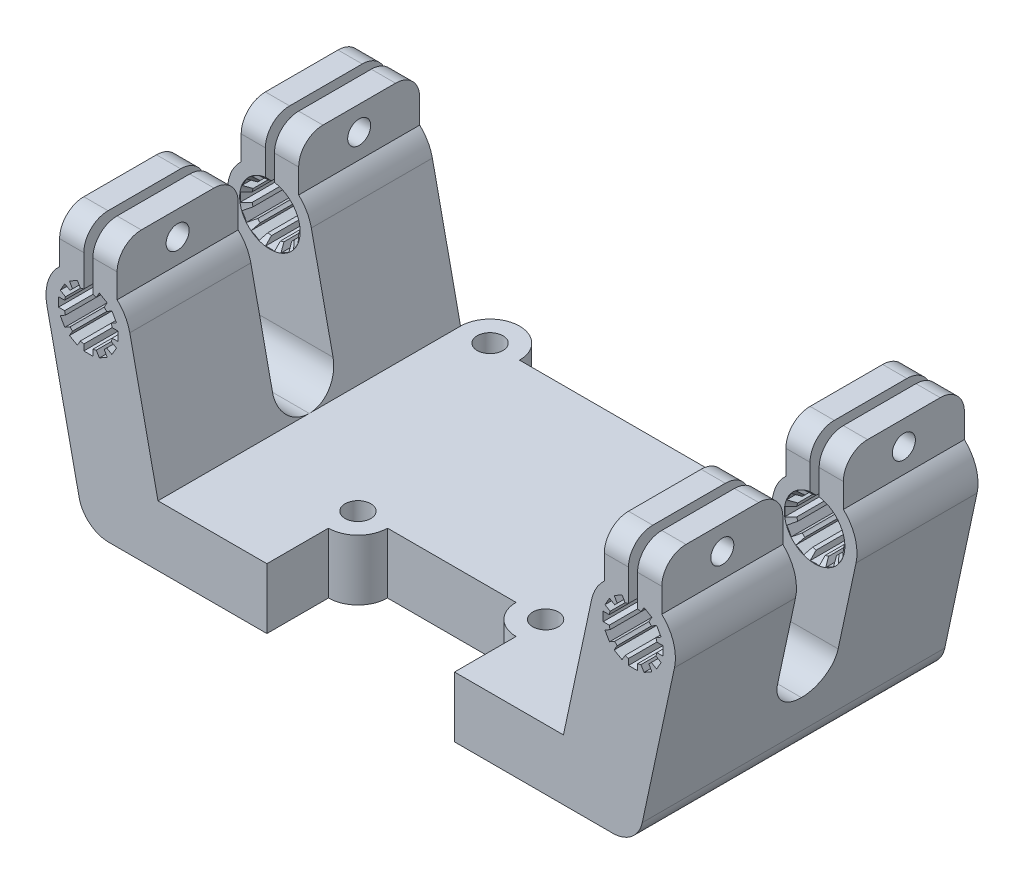
from build123d import *

# Parameters (mm, degrees)
SKETCH1_R                       = 2.125
BOSS_EXTRUDE1_DEPTH             = 10
BOSS_EXTRUDE3_REACH             = 46.442
BOSS_EXTRUDE3_DIRECTION_2_REACH = 46.442
SKETCH6_W                       = 1.5
SKETCH6_H                       = 1
SKETCH6_W_2                     = 1
SKETCH6_H_2                     = 1.5
CUT_EXTRUDE2_DEPTH              = 50
CUT_EXTRUDE3_DEPTH              = 74.069291688
CUT_EXTRUDE3_DEPTH_BACK         = 74.069291688
SKETCH7_W                       = 10
SKETCH7_H                       = 33.385538852
FILLET9_R                       = 5
SKETCH10_R                      = 1.9
CUT_EXTRUDE4_DEPTH              = 114.965713712
FILLET12_R                      = 4


with BuildPart() as part:
    # Sketch1 → Boss-Extrude1 (new body)
    with BuildSketch(Plane(origin=(0, 0, 0), x_dir=(1, 0, 0), z_dir=(0, 1, 0))):
        with BuildLine():
            Line((23.75, 22.5625), (-23.75, 22.5625))
            ThreePointArc((-23.75, 22.5625), (-28.625, 27.4375), (-33.5, 22.5625))
            Line((-33.5, 22.5625), (-33.5, -27.4375))
            Line((-33.5, -27.4375), (-27, -27.4375))
            Line((-27, -27.4375), (-22, -27.4375))
            Line((-22, -27.4375), (-15.5, -27.4375))
            Line((-15.5, -27.4375), (-15.5, -17.2625))
            ThreePointArc((-15.5, -17.2625), (-12.052854442, -15.834645558), (-10.625, -12.3875))
            Line((-10.625, -12.3875), (10.625, -12.3875))
            ThreePointArc((10.625, -12.3875), (12.052854442, -15.834645558), (15.5, -17.2625))
            Line((15.5, -17.2625), (15.5, -27.4375))
            Line((15.5, -27.4375), (22, -27.4375))
            Line((22, -27.4375), (27, -27.4375))
            Line((27, -27.4375), (33.5, -27.4375))
            Line((33.5, -27.4375), (33.5, 22.5625))
            ThreePointArc((33.5, 22.5625), (28.625, 27.4375), (23.75, 22.5625))
        make_face()
        with Locations(Location((-28.625, 22.5625, 0), (0, 0, 270))):
            Circle(SKETCH1_R, mode=Mode.SUBTRACT)
        with Locations(Location((-15.5, -12.3875, 0), (0, 0, 270))):
            Circle(SKETCH1_R, mode=Mode.SUBTRACT)
        with Locations(Location((15.5, -12.3875, 0), (0, 0, 270))):
            Circle(SKETCH1_R, mode=Mode.SUBTRACT)
        with Locations(Location((28.625, 22.5625, 0), (0, 0, 270))):
            Circle(SKETCH1_R, mode=Mode.SUBTRACT)
    extrude(amount=BOSS_EXTRUDE1_DEPTH)

    # Boss-Extrude3: up to this face of the body (flat: up to its plane)
    boss_extrude3_end = Plane(part.part.faces().sort_by_distance((-24.5, 5, 27.4375))[0])
    # Sketch5 → Boss-Extrude3 (add, up to the picked face)
    with BuildSketch(Plane.XY, mode=Mode.PRIVATE) as boss_extrude3_sk1:
        with BuildLine():
            Line((-33.5, 10), (-38.155585507, 31.711445762))
            ThreePointArc((-38.155585507, 31.711445762), (-38.91868831, 33.710445869), (-40.25, 35.385538852))
            Line((-40.25, 35.385538852), (-40.25, 43.385538852))
            Line((-40.25, 43.385538852), (-44.25, 43.385538852))
            Line((-44.25, 43.385538852), (-44.25, 34.172856313))
            ThreePointArc((-44.25, 34.172856313), (-45, 26.243797902), (-45.75, 34.172856313))
            Line((-45.75, 34.172856313), (-45.75, 43.385538852))
            Line((-45.75, 43.385538852), (-49.75, 43.385538852))
            Line((-49.75, 43.385538852), (-49.75, 35.385538852))
            ThreePointArc((-49.75, 35.385538852), (-51.67297662, 32.358362402), (-51.844414493, 28.776150041))
            Line((-51.844414493, 28.776150041), (-45.673944386, 0))
            Line((-45.673944386, 0), (-33.5, 0))
            Line((-33.5, 0), (-33.5, 10))
        make_face()
    boss_extrude3_tool1 = split(extrude(boss_extrude3_sk1.sketch, amount=BOSS_EXTRUDE3_REACH, mode=Mode.PRIVATE), bisect_by=boss_extrude3_end, keep=Keep.BOTH, mode=Mode.PRIVATE)
    boss_extrude3 = boss_extrude3_tool1.solids().sort_by(Axis((-42.44705, 19.174072, 0), (0, 0, 1)))[0]
    add(boss_extrude3)

    # Boss-Extrude3 direction 2: up to this face of the body (flat: up to its plane)
    boss_extrude3_direction_2_end = Plane(part.part.faces().sort_by_distance((0, 5, -22.5625))[0])
    # Sketch5 → Boss-Extrude3 direction 2 (add, up to the picked face)
    with BuildSketch(Plane.XY, mode=Mode.PRIVATE) as boss_extrude3_direction_2_sk1:
        with BuildLine():
            Line((-33.5, 10), (-38.155585507, 31.711445762))
            ThreePointArc((-38.155585507, 31.711445762), (-38.91868831, 33.710445869), (-40.25, 35.385538852))
            Line((-40.25, 35.385538852), (-40.25, 43.385538852))
            Line((-40.25, 43.385538852), (-44.25, 43.385538852))
            Line((-44.25, 43.385538852), (-44.25, 34.172856313))
            ThreePointArc((-44.25, 34.172856313), (-45, 26.243797902), (-45.75, 34.172856313))
            Line((-45.75, 34.172856313), (-45.75, 43.385538852))
            Line((-45.75, 43.385538852), (-49.75, 43.385538852))
            Line((-49.75, 43.385538852), (-49.75, 35.385538852))
            ThreePointArc((-49.75, 35.385538852), (-51.67297662, 32.358362402), (-51.844414493, 28.776150041))
            Line((-51.844414493, 28.776150041), (-45.673944386, 0))
            Line((-45.673944386, 0), (-33.5, 0))
            Line((-33.5, 0), (-33.5, 10))
        make_face()
    boss_extrude3_direction_2_tool1 = split(extrude(boss_extrude3_direction_2_sk1.sketch, amount=-BOSS_EXTRUDE3_DIRECTION_2_REACH, mode=Mode.PRIVATE), bisect_by=boss_extrude3_direction_2_end, keep=Keep.BOTH, mode=Mode.PRIVATE)
    boss_extrude3_direction_2 = boss_extrude3_direction_2_tool1.solids().sort_by(Axis((-42.44705, 19.174072, 0), (0, 0, -1)))[0]
    add(boss_extrude3_direction_2)

    # Mirror2: Boss-Extrude3, Boss-Extrude3 direction 2 across plane
    add(boss_extrude3.mirror(Plane(origin=(0, 0, 0), x_dir=(0, 0, 1), z_dir=(1, 0, 0))))
    add(boss_extrude3_direction_2.mirror(Plane(origin=(0, 0, 0), x_dir=(0, 0, 1), z_dir=(1, 0, 0))))

    # Sketch6 → Cut-Extrude2 (cut)
    with BuildSketch(Plane.XY.offset(27.4375)):
        with Locations((-45, 34.672856313)):
            Rectangle(SKETCH6_W, SKETCH6_H)
        Polygon((-43.184995739, 34.887487795), (-43.684995739, 34.021462391), (-42.385957634, 33.271462391), (-41.885957634, 34.137487795), align=None)
        Polygon((-41.106321148, 33.357849278), (-41.972346551, 32.857849278), (-41.222346551, 31.558811173), (-40.356321148, 32.058811173), align=None)
        with Locations((-40.570955404, 30.243806168)):
            Rectangle(SKETCH6_W_2, SKETCH6_H_2)
        Polygon((-40.356323922, 28.428801908), (-41.222349325, 28.928801908), (-41.972349325, 27.629763802), (-41.106323922, 27.129763802), align=None)
        Polygon((-41.885962438, 26.350127316), (-42.385962438, 27.21615272), (-43.685000544, 26.46615272), (-43.185000544, 25.600127316), align=None)
        with Locations((-45.000005548, 25.814761572)):
            Rectangle(SKETCH6_W, SKETCH6_H)
        Polygon((-46.815009809, 25.60013009), (-46.315009809, 26.466155494), (-47.614047915, 27.216155494), (-48.114047915, 26.35013009), align=None)
        Polygon((-48.8936844, 27.129768607), (-48.027658997, 27.629768607), (-48.777658997, 28.928806712), (-49.6436844, 28.428806712), align=None)
        with Locations((-49.429050145, 30.243811717)):
            Rectangle(SKETCH6_W_2, SKETCH6_H_2)
        Polygon((-49.643681626, 32.058815977), (-48.777656223, 31.558815977), (-48.027656223, 32.857854083), (-48.893681626, 33.357854083), align=None)
        Polygon((-48.11404311, 34.137490569), (-47.61404311, 33.271465165), (-46.315005004, 34.021465165), (-46.815005004, 34.887490569), align=None)
    cut_extrude2 = extrude(amount=-CUT_EXTRUDE2_DEPTH, mode=Mode.SUBTRACT)

    # Mirror3: Cut-Extrude2 across plane
    add(cut_extrude2.mirror(Plane(origin=(0, 0, 0), x_dir=(0, 0, 1), z_dir=(1, 0, 0))), mode=Mode.SUBTRACT)

    # Sketch7 → Cut-Extrude3 (cut, two sides: drawn at the far end of the back side and taken through both)
    with BuildSketch(Plane(origin=(0, 0, 0), x_dir=(0, 0, -1), z_dir=(1, 0, 0)).offset(-CUT_EXTRUDE3_DEPTH_BACK)):
        with Locations((-2.4375, 26.692769426)):
            Rectangle(SKETCH7_W, SKETCH7_H)
    extrude(amount=CUT_EXTRUDE3_DEPTH + CUT_EXTRUDE3_DEPTH_BACK, mode=Mode.SUBTRACT)

    # Fillet9
    fillet9_edges = [part.edges().sort_by_distance(p)[0] for p in [
        (-45.673944386, 0, 2.4375),
        (45.673944386, 0, 2.4375),
        (40.659122237, 10, 7.4375),
        (40.659122237, 10, -2.5625),
        (-40.659122237, 10, 7.4375),
        (-40.659122237, 10, -2.5625),
    ]]
    fillet(fillet9_edges, radius=FILLET9_R - 0.0001)  # a hair under: the kernel refuses the full size

    # Chamfer4: read off the stored shape, not the designer's step
    # Chamfer4: loft between two sections, ruled curve by curve
    chamfer4_from = [
        Edge.make_three_point_arc((44.400000709, 34.198537216, -3.562504726), (41.011334762, 29.94294609, -3.562504726), (45, 26.243802628, -3.562504726)),
        Edge.make_three_point_arc((45, 26.243802628, -3.562504726), (48.988665238, 29.94294609, -3.562504726), (45.599999291, 34.198537216, -3.562504726)),
        Edge.make_line((45.599999291, 34.198537216, -3.562504726), (44.400000709, 34.198537216, -3.562504726)),
    ]
    chamfer4_to = [
        Edge.make_three_point_arc((44.25, 35.187227885, -2.5625), (40.014162562, 29.867732692, -2.5625), (45, 25.243797902, -2.5625)),
        Edge.make_three_point_arc((45, 25.243797902, -2.5625), (49.985837438, 29.867732692, -2.5625), (45.75, 35.187227885, -2.5625)),
        Edge.make_line((45.75, 35.187227885, -2.5625), (44.25, 35.187227885, -2.5625)),
    ]
    chamfer4 = Solid(Shell([*[Face.make_surface_from_curves(chamfer4_from[k], chamfer4_to[k]) for k in range(3)], Face(Wire(chamfer4_from)), Face(Wire(chamfer4_to))]))
    add(chamfer4, mode=Mode.SUBTRACT)

    # Chamfer4 2: loft between two sections, ruled curve by curve
    chamfer4_2_from = [
        Edge.make_three_point_arc((45.599999301, 34.198537284, -21.562495342), (48.988665306, 29.942946084, -21.562495342), (45, 26.243802559, -21.562495342)),
        Edge.make_three_point_arc((45, 26.243802559, -21.562495342), (41.011334694, 29.942946084, -21.562495342), (44.400000699, 34.198537284, -21.562495342)),
        Edge.make_line((44.400000699, 34.198537284, -21.562495342), (45.599999301, 34.198537284, -21.562495342)),
    ]
    chamfer4_2_to = [
        Edge.make_three_point_arc((45.75, 35.187227885, -22.5625), (49.985837438, 29.867732692, -22.5625), (45, 25.243797902, -22.5625)),
        Edge.make_three_point_arc((45, 25.243797902, -22.5625), (40.014162562, 29.867732692, -22.5625), (44.25, 35.187227885, -22.5625)),
        Edge.make_line((44.25, 35.187227885, -22.5625), (45.75, 35.187227885, -22.5625)),
    ]
    chamfer4_2 = Solid(Shell([*[Face.make_surface_from_curves(chamfer4_2_from[k], chamfer4_2_to[k]) for k in range(3)], Face(Wire(chamfer4_2_from)), Face(Wire(chamfer4_2_to))]))
    add(chamfer4_2, mode=Mode.SUBTRACT)

    # Chamfer4 3: loft between two sections, ruled curve by curve
    chamfer4_3_from = [
        Edge.make_three_point_arc((45.599999301, 34.198537284, 8.437504658), (48.988665306, 29.942946084, 8.437504658), (45, 26.243802559, 8.437504658)),
        Edge.make_three_point_arc((45, 26.243802559, 8.437504658), (41.011334694, 29.942946084, 8.437504658), (44.400000699, 34.198537284, 8.437504658)),
        Edge.make_line((44.400000699, 34.198537284, 8.437504658), (45.599999301, 34.198537284, 8.437504658)),
    ]
    chamfer4_3_to = [
        Edge.make_three_point_arc((45.75, 35.187227885, 7.4375), (49.985837438, 29.867732692, 7.4375), (45, 25.243797902, 7.4375)),
        Edge.make_three_point_arc((45, 25.243797902, 7.4375), (40.014162562, 29.867732692, 7.4375), (44.25, 35.187227885, 7.4375)),
        Edge.make_line((44.25, 35.187227885, 7.4375), (45.75, 35.187227885, 7.4375)),
    ]
    chamfer4_3 = Solid(Shell([*[Face.make_surface_from_curves(chamfer4_3_from[k], chamfer4_3_to[k]) for k in range(3)], Face(Wire(chamfer4_3_from)), Face(Wire(chamfer4_3_to))]))
    add(chamfer4_3, mode=Mode.SUBTRACT)

    # Chamfer4 4: loft between two sections, ruled curve by curve
    chamfer4_4_from = [
        Edge.make_three_point_arc((-45.599999301, 34.198537284, -3.562504658), (-48.988665306, 29.942946084, -3.562504658), (-45, 26.243802559, -3.562504658)),
        Edge.make_three_point_arc((-45, 26.243802559, -3.562504658), (-41.011334694, 29.942946084, -3.562504658), (-44.400000699, 34.198537284, -3.562504658)),
        Edge.make_line((-44.400000699, 34.198537284, -3.562504658), (-45.599999301, 34.198537284, -3.562504658)),
    ]
    chamfer4_4_to = [
        Edge.make_three_point_arc((-45.75, 35.187227885, -2.5625), (-49.985837438, 29.867732692, -2.5625), (-45, 25.243797902, -2.5625)),
        Edge.make_three_point_arc((-45, 25.243797902, -2.5625), (-40.014162562, 29.867732692, -2.5625), (-44.25, 35.187227885, -2.5625)),
        Edge.make_line((-44.25, 35.187227885, -2.5625), (-45.75, 35.187227885, -2.5625)),
    ]
    chamfer4_4 = Solid(Shell([*[Face.make_surface_from_curves(chamfer4_4_from[k], chamfer4_4_to[k]) for k in range(3)], Face(Wire(chamfer4_4_from)), Face(Wire(chamfer4_4_to))]))
    add(chamfer4_4, mode=Mode.SUBTRACT)

    # Chamfer4 5: loft between two sections, ruled curve by curve
    chamfer4_5_from = [
        Edge.make_three_point_arc((-44.400000709, 34.198537216, 8.437504726), (-41.011334762, 29.94294609, 8.437504726), (-45, 26.243802628, 8.437504726)),
        Edge.make_three_point_arc((-45, 26.243802628, 8.437504726), (-48.988665238, 29.94294609, 8.437504726), (-45.599999291, 34.198537216, 8.437504726)),
        Edge.make_line((-45.599999291, 34.198537216, 8.437504726), (-44.400000709, 34.198537216, 8.437504726)),
    ]
    chamfer4_5_to = [
        Edge.make_three_point_arc((-44.25, 35.187227885, 7.4375), (-40.014162562, 29.867732692, 7.4375), (-45, 25.243797902, 7.4375)),
        Edge.make_three_point_arc((-45, 25.243797902, 7.4375), (-49.985837438, 29.867732692, 7.4375), (-45.75, 35.187227885, 7.4375)),
        Edge.make_line((-45.75, 35.187227885, 7.4375), (-44.25, 35.187227885, 7.4375)),
    ]
    chamfer4_5 = Solid(Shell([*[Face.make_surface_from_curves(chamfer4_5_from[k], chamfer4_5_to[k]) for k in range(3)], Face(Wire(chamfer4_5_from)), Face(Wire(chamfer4_5_to))]))
    add(chamfer4_5, mode=Mode.SUBTRACT)

    # Chamfer4 6: loft between two sections, ruled curve by curve
    chamfer4_6_from = [
        Edge.make_three_point_arc((-44.400000709, 34.198537216, -21.562495274), (-41.011334762, 29.94294609, -21.562495274), (-45, 26.243802628, -21.562495274)),
        Edge.make_three_point_arc((-45, 26.243802628, -21.562495274), (-48.988665238, 29.94294609, -21.562495274), (-45.599999291, 34.198537216, -21.562495274)),
        Edge.make_line((-45.599999291, 34.198537216, -21.562495274), (-44.400000709, 34.198537216, -21.562495274)),
    ]
    chamfer4_6_to = [
        Edge.make_three_point_arc((-44.25, 35.187227885, -22.5625), (-40.014162562, 29.867732692, -22.5625), (-45, 25.243797902, -22.5625)),
        Edge.make_three_point_arc((-45, 25.243797902, -22.5625), (-49.985837438, 29.867732692, -22.5625), (-45.75, 35.187227885, -22.5625)),
        Edge.make_line((-45.75, 35.187227885, -22.5625), (-44.25, 35.187227885, -22.5625)),
    ]
    chamfer4_6 = Solid(Shell([*[Face.make_surface_from_curves(chamfer4_6_from[k], chamfer4_6_to[k]) for k in range(3)], Face(Wire(chamfer4_6_from)), Face(Wire(chamfer4_6_to))]))
    add(chamfer4_6, mode=Mode.SUBTRACT)

    # Sketch10 → Cut-Extrude4 (cut, through all)
    with BuildSketch(Plane.ZY.offset(49.75)):
        with Locations((-12.5625, 39.385538852)):
            Circle(SKETCH10_R)
        with Locations((17.4375, 39.385538852)):
            Circle(SKETCH10_R)
    extrude(amount=-CUT_EXTRUDE4_DEPTH, mode=Mode.SUBTRACT)

    # Fillet12
    fillet12_edges = [part.edges().sort_by_distance(p)[0] for p in [
        (-47.75, 43.385538852, 27.4375),
        (-42.25, 43.385538852, 27.4375),
        (-47.75, 43.385538852, -22.5625),
        (-42.25, 43.385538852, -22.5625),
        (-47.75, 43.385538852, 7.4375),
        (-42.25, 43.385538852, 7.4375),
        (47.75, 43.385538852, 7.4375),
        (-42.25, 43.385538852, -2.5625),
        (-47.75, 43.385538852, -2.5625),
        (42.25, 43.385538852, -2.5625),
        (47.75, 43.385538852, -2.5625),
        (42.25, 43.385538852, 7.4375),
        (47.75, 43.385538852, -22.5625),
        (42.25, 43.385538852, -22.5625),
        (47.75, 43.385538852, 27.4375),
        (42.25, 43.385538852, 27.4375),
    ]]
    fillet(fillet12_edges, radius=FILLET12_R)


solid = part.part
